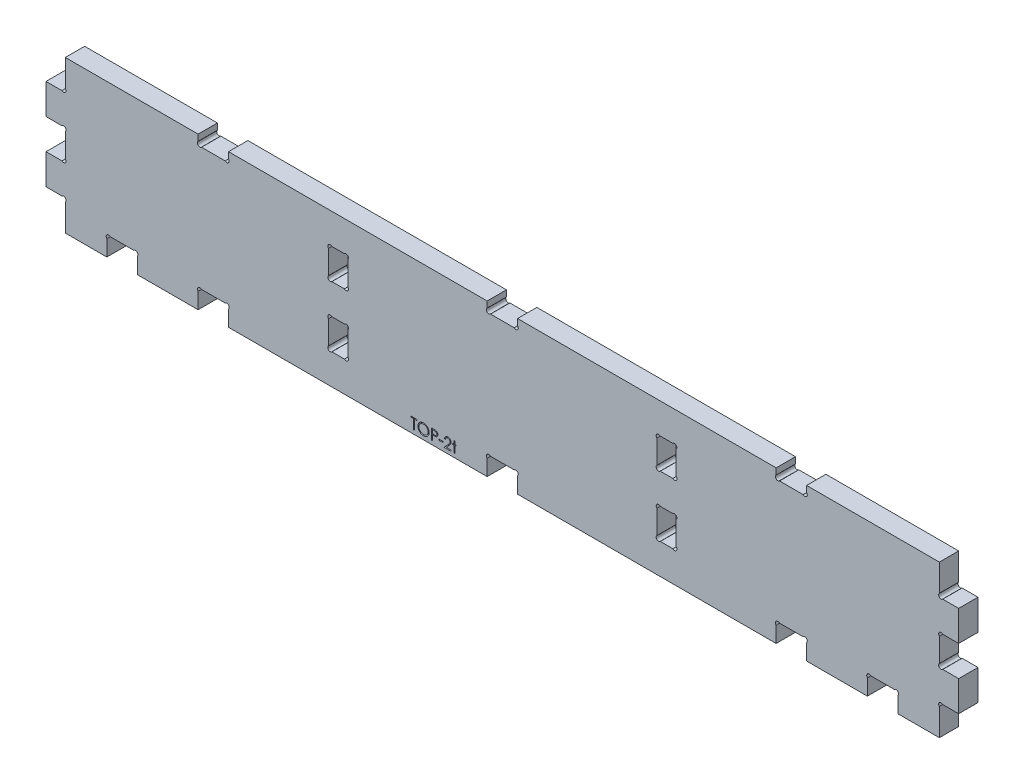
from build123d import *

# Parameters (mm, degrees)
BOSS_EXTRUDE1_OUTLINE_W        = 50
BOSS_EXTRUDE1_OUTLINE_H        = 6.35
BOSS_EXTRUDE1_DEPTH            = 300
SKETCH1_W                      = 10
SKETCH1_H                      = 6.35
F_250_TOOTH_DEPTH              = 305.204409074
F_1_16_0_0625_DIAMETER_HOLE1_D = 1.5875
LPATTERN1_COUNT                = 2
LPATTERN1_PITCH                = 95
LPATTERN1_COL_COUNT            = 2
LPATTERN1_COL_PITCH            = 95
LPATTERN4_COUNT                = 2
LPATTERN4_PITCH                = 125
LPATTERN4_COL_COUNT            = 2
LPATTERN4_COL_PITCH            = 125
SKETCH7_W                      = 6.35
SKETCH7_H                      = 10
F_2T_CUT_DEPTH                 = 305.204409074
LPATTERN2_COUNT                = 3
LPATTERN2_PITCH                = 20
F_1_16_0_0625_DIAMETER_HOLE3_D = 1.5875
MIRROR2_COPY_1_SKETCH_W        = 6.35
MIRROR2_COPY_1_SKETCH_H        = 10
MIRROR2_COPY_1_DEPTH           = 305.204409074
MIRROR2_COPY_2_SKETCH_W        = 6.35
MIRROR2_COPY_2_SKETCH_H        = 10
MIRROR2_COPY_2_DEPTH           = 305.204409074
SKETCH14_W                     = 10
SKETCH14_H                     = 3.175
F_125_TOOTH_DEPTH              = 305.204409074
F_1_16_0_0625_DIAMETER_HOLE2_D = 1.5875
LPATTERN3_COUNT                = 2
LPATTERN3_PITCH                = 95
LPATTERN3_COL_COUNT            = 2
LPATTERN3_COL_PITCH            = 95
SKETCH29_W                     = 6.35
SKETCH29_H                     = 10
CUT_EXTRUDE2_DEPTH             = 305.204409074
F_1_16_0_0625_DIAMETER_HOLE5_D = 1.5875
SKETCH33_W                     = 1.346153846
SKETCH33_H                     = 0.358974359
ETCH_DEPTH                     = 1.25


# Read off the part's stored shape, not the designer's step: Boss-Extrude1
with BuildPart() as part:
    # Boss-Extrude1 outline → Boss-Extrude1 (new body)
    with BuildSketch(Plane.YZ):
        with Locations((25, 3.175)):
            Rectangle(BOSS_EXTRUDE1_OUTLINE_W, BOSS_EXTRUDE1_OUTLINE_H)
    extrude(amount=BOSS_EXTRUDE1_DEPTH)

    # Sketch1 → 250-tooth (cut, through all)
    with BuildSketch(Plane.XY.offset(6.35)):
        with Locations((150, 3.175)):
            Rectangle(SKETCH1_W, SKETCH1_H)
    f_250_tooth = extrude(amount=-F_250_TOOTH_DEPTH, mode=Mode.SUBTRACT)

    # 1/16 (0.0625) Diameter Hole1 (through all)
    with Locations(Plane.XY.offset(6.35)):
        with Locations((145.5588, 5.7912), (150, 3.175), (154.4412, 5.7912)):
            f_1_16_0_0625_diameter_hole1 = Hole(F_1_16_0_0625_DIAMETER_HOLE1_D / 2)

    # LPattern1: 250-tooth, 1/16 (0.0625) Diameter Hole1 ×2
    with Locations(*[(i * LPATTERN1_PITCH, 0, 0) for i in range(1, LPATTERN1_COUNT)]):
        add(f_250_tooth, mode=Mode.SUBTRACT)
        add(f_1_16_0_0625_diameter_hole1, mode=Mode.SUBTRACT)

    # LPattern1 col: 250-tooth, 1/16 (0.0625) Diameter Hole1 ×2
    with Locations(*[(-i * LPATTERN1_COL_PITCH, 0, 0) for i in range(1, LPATTERN1_COL_COUNT)]):
        add(f_250_tooth, mode=Mode.SUBTRACT)
        add(f_1_16_0_0625_diameter_hole1, mode=Mode.SUBTRACT)

    # LPattern4: 250-tooth, 1/16 (0.0625) Diameter Hole1 ×2
    with Locations(*[(i * LPATTERN4_PITCH, 0, 0) for i in range(1, LPATTERN4_COUNT)]):
        add(f_250_tooth, mode=Mode.SUBTRACT)
        add(f_1_16_0_0625_diameter_hole1, mode=Mode.SUBTRACT)

    # LPattern4 col: 250-tooth, 1/16 (0.0625) Diameter Hole1 ×2
    with Locations(*[(-i * LPATTERN4_COL_PITCH, 0, 0) for i in range(1, LPATTERN4_COL_COUNT)]):
        add(f_250_tooth, mode=Mode.SUBTRACT)
        add(f_1_16_0_0625_diameter_hole1, mode=Mode.SUBTRACT)

    # Sketch7 → 2t_cut (cut, through all)
    with BuildSketch(Plane.XY.offset(6.35)):
        with Locations((3.175, 45)):
            Rectangle(SKETCH7_W, SKETCH7_H)
    f_2t_cut = extrude(amount=-F_2T_CUT_DEPTH, mode=Mode.SUBTRACT)

    # LPattern2: 2t_cut ×3
    with Locations(*[(0, -i * LPATTERN2_PITCH, 0) for i in range(1, LPATTERN2_COUNT)]):
        add(f_2t_cut, mode=Mode.SUBTRACT)

    # 1/16 (0.0625) Diameter Hole3 (through all)
    with Locations(Plane.XY.offset(6.35)):
        with Locations((5.7912, 9.4412), (5.7912, 40.5588), (5.7912, 29.4412), (5.7912, 20.5588)):
            f_1_16_0_0625_diameter_hole3 = Hole(F_1_16_0_0625_DIAMETER_HOLE3_D / 2)

    # Mirror2: 2t_cut, 1/16 (0.0625) Diameter Hole3 across plane
    add(f_2t_cut.mirror(Plane(origin=(150, 0, 0), x_dir=(0, 0, 1), z_dir=(1, 0, 0))), mode=Mode.SUBTRACT)
    add(f_1_16_0_0625_diameter_hole3.mirror(Plane(origin=(150, 0, 0), x_dir=(0, 0, 1), z_dir=(1, 0, 0))), mode=Mode.SUBTRACT)

    # Mirror2 copy 1 sketch → Mirror2 copy 1 (cut, through all)
    with BuildSketch(Plane(origin=(300, -20, 6.35), x_dir=(-1, 0, 0), z_dir=(0, 0, 1))):
        with Locations((3.175, -45)):
            Rectangle(MIRROR2_COPY_1_SKETCH_W, MIRROR2_COPY_1_SKETCH_H)
    extrude(amount=-MIRROR2_COPY_1_DEPTH, mode=Mode.SUBTRACT)

    # Mirror2 copy 2 sketch → Mirror2 copy 2 (cut, through all)
    with BuildSketch(Plane(origin=(300, -40, 6.35), x_dir=(-1, 0, 0), z_dir=(0, 0, 1))):
        with Locations((3.175, -45)):
            Rectangle(MIRROR2_COPY_2_SKETCH_W, MIRROR2_COPY_2_SKETCH_H)
    extrude(amount=-MIRROR2_COPY_2_DEPTH, mode=Mode.SUBTRACT)

    # Sketch14 → 125-tooth (cut, through all)
    with BuildSketch(Plane.XY.offset(6.35)):
        with Locations((150, 48.4125)):
            Rectangle(SKETCH14_W, SKETCH14_H)
    f_125_tooth = extrude(amount=-F_125_TOOTH_DEPTH, mode=Mode.SUBTRACT)

    # 1/16 (0.0625) Diameter Hole2 (through all)
    with Locations(Plane.XY.offset(6.35)):
        with Locations((154.4412, 47.3838), (150, 48.4125), (145.5588, 47.3838)):
            f_1_16_0_0625_diameter_hole2 = Hole(F_1_16_0_0625_DIAMETER_HOLE2_D / 2)

    # LPattern3: 125-tooth, 1/16 (0.0625) Diameter Hole2 ×2
    with Locations(*[(i * LPATTERN3_PITCH, 0, 0) for i in range(1, LPATTERN3_COUNT)]):
        add(f_125_tooth, mode=Mode.SUBTRACT)
        add(f_1_16_0_0625_diameter_hole2, mode=Mode.SUBTRACT)

    # LPattern3 col: 125-tooth, 1/16 (0.0625) Diameter Hole2 ×2
    with Locations(*[(-i * LPATTERN3_COL_PITCH, 0, 0) for i in range(1, LPATTERN3_COL_COUNT)]):
        add(f_125_tooth, mode=Mode.SUBTRACT)
        add(f_1_16_0_0625_diameter_hole2, mode=Mode.SUBTRACT)

    # Sketch29 → Cut-Extrude2 (cut, through all)
    with BuildSketch(Plane.XY.offset(6.35)):
        with Locations((96.025, 34.999999939)):
            Rectangle(SKETCH29_W, SKETCH29_H)
    cut_extrude2 = extrude(amount=-CUT_EXTRUDE2_DEPTH, mode=Mode.SUBTRACT)

    # 1/16 (0.0625) Diameter Hole5 (through all)
    with Locations(Plane.XY.offset(6.35)):
        with Locations((93.4088, 39.441199939), (98.6412, 30.558799939), (93.4088, 30.558799939), (98.6412, 39.441199939)):
            f_1_16_0_0625_diameter_hole5 = Hole(F_1_16_0_0625_DIAMETER_HOLE5_D / 2)

    # Sketch-Pattern1: Cut-Extrude2, 1/16 (0.0625) Diameter Hole5 at 3 more places
    with Locations((107.95, 0, 0), (107.95, -20, 0), (0, -20, 0)):
        add(cut_extrude2, mode=Mode.SUBTRACT)
        add(f_1_16_0_0625_diameter_hole5, mode=Mode.SUBTRACT)

    # Sketch33 → etch (cut)
    # profile 1 of 6: a face of its own
    with BuildSketch(Plane.XY.offset(6.35)):
        Polygon((134.057692308, 4.83974359), (134.371794872, 4.83974359), (134.371794872, 3.807692308), (134.820512821, 3.807692308), (134.820512821, 3.493589744), (134.371794872, 3.493589744), (134.371794872, 1.25), (134.057692308, 1.25), (134.057692308, 3.493589744), (133.608974359, 3.493589744), (133.608974359, 3.807692308), (134.057692308, 3.807692308), align=None)
    # profile 2 of 6: a face of its own
    with BuildSketch(Plane.XY.offset(6.35)):
        with BuildLine():
            Line((131.275641026, 3.673076923), (130.961538462, 3.673076923))
            add(Edge.make_bspline(
                [(130.961538462, 3.673076923), (130.963585615, 3.714747811), (130.967606169, 3.796588325), (130.986434458, 3.915912232), (131.013375335, 4.029967031), (131.051466789, 4.137836945), (131.098773067, 4.240475752), (131.155503094, 4.337475767), (131.222696945, 4.428466956), (131.298903679, 4.512605799), (131.381672318, 4.58979337), (131.470978257, 4.656448613), (131.564823285, 4.712766284), (131.662922684, 4.759847526), (131.766383247, 4.795187372), (131.874266105, 4.821409012), (131.987045241, 4.837185357), (132.063885263, 4.838881143), (132.102964744, 4.83974359)],
                knots=[0, 0, 0, 0, 1.10065271, 2.161652631, 3.183658789, 4.190468796, 5.17591951, 6.163126047, 7.15150782, 8.156236427, 9.156009102, 10.134482811, 11.092018607, 12.041330605, 13.001268258, 13.972401359, 14.968799086, 16, 16, 16, 16], degree=3))
            add(Edge.make_bspline(
                [(132.102964744, 4.83974359), (132.141342818, 4.838845133), (132.216754362, 4.837079698), (132.326816377, 4.821918669), (132.431593671, 4.798173078), (132.530881438, 4.764857661), (132.623887502, 4.720073234), (132.711310547, 4.666275695), (132.794191358, 4.604055864), (132.868798141, 4.53080205), (132.937306221, 4.452599666), (132.996408476, 4.369111762), (133.047021639, 4.282882477), (133.089209319, 4.193254275), (133.120265458, 4.099383247), (133.143843666, 4.002636044), (133.15717108, 3.902011233), (133.159216503, 3.833904677), (133.16025641, 3.799278846)],
                knots=[0, 0, 0, 0, 1.111607364, 2.184268762, 3.212621178, 4.221274766, 5.211760367, 6.196651075, 7.1921475, 8.207485113, 9.220403448, 10.201281604, 11.166441695, 12.114753415, 13.065576456, 14.026450734, 14.996634279, 16, 16, 16, 16], degree=3))
            add(Edge.make_bspline(
                [(133.16025641, 3.799278846), (133.158563147, 3.750531012), (133.155206336, 3.653890798), (133.126491959, 3.511875935), (133.081645448, 3.374282516), (133.027648092, 3.263545214), (132.973175647, 3.17431172), (132.92408814, 3.100843015), (132.866623329, 3.021737547), (132.799944831, 2.93726021), (132.725431959, 2.846749304), (132.642409795, 2.750259509), (132.550286313, 2.648787739), (132.485627813, 2.579482138), (132.452123397, 2.543569712)],
                knots=[0, 0, 0, 0, 1.184426356, 2.348067706, 3.509069118, 4.696110526, 5.333549288, 6.050745305, 6.844228056, 7.710549037, 8.667450064, 9.695053472, 10.805634456, 12, 12, 12, 12], degree=3))
            Line((132.452123397, 2.543569712), (131.576422276, 1.608974359))
            Line((131.576422276, 1.608974359), (133.205128205, 1.608974359))
            Line((133.205128205, 1.608974359), (133.205128205, 1.25))
            Line((133.205128205, 1.25), (130.826923077, 1.25))
            Line((130.826923077, 1.25), (132.184294872, 2.698517628))
            add(Edge.make_bspline(
                [(132.184294872, 2.698517628), (132.217342759, 2.733015935), (132.280820986, 2.799280121), (132.370603563, 2.896023081), (132.451242551, 2.985772622), (132.523259944, 3.068359171), (132.585093449, 3.144990738), (132.639965681, 3.213185442), (132.683931272, 3.275939892), (132.731646668, 3.348680506), (132.777860649, 3.437492823), (132.817573005, 3.546026513), (132.841787853, 3.657753765), (132.844692689, 3.733255802), (132.846153846, 3.771233974)],
                knots=[0, 0, 0, 0, 1.329631726, 2.553950428, 3.673215718, 4.687767853, 5.603093632, 6.413772471, 7.123043292, 7.734684054, 8.834405432, 9.900288307, 10.943827018, 12, 12, 12, 12], degree=3))
            add(Edge.make_bspline(
                [(132.846153846, 3.771233974), (132.845518104, 3.795115373), (132.844265178, 3.842181023), (132.83320748, 3.911186782), (132.816496974, 3.977751596), (132.792551716, 4.042080215), (132.760944976, 4.103525867), (132.722471596, 4.162163347), (132.678081533, 4.218852313), (132.626730263, 4.272005611), (132.570318744, 4.320686816), (132.510724494, 4.363810902), (132.44767439, 4.399850012), (132.381434268, 4.429393509), (132.312188798, 4.452568891), (132.239804053, 4.46862747), (132.164480037, 4.478709954), (132.113046541, 4.480074126), (132.086838942, 4.480769231)],
                knots=[0, 0, 0, 0, 0.991446411, 1.95395049, 2.89581595, 3.838931463, 4.798493298, 5.75982156, 6.748411868, 7.785213223, 8.824556874, 9.840280684, 10.836137867, 11.835679398, 12.848801643, 13.863922112, 14.911575587, 16, 16, 16, 16], degree=3))
            add(Edge.make_bspline(
                [(132.086838942, 4.480769231), (132.05946811, 4.480054199), (132.005716313, 4.478649993), (131.92679728, 4.468827329), (131.851511503, 4.451881489), (131.7796696, 4.428704814), (131.711150014, 4.399246266), (131.64628597, 4.362554521), (131.585223081, 4.318771028), (131.527846557, 4.269130471), (131.474982578, 4.21386287), (131.428535703, 4.152252907), (131.387951688, 4.085425492), (131.352542455, 4.013560941), (131.323786765, 3.936007161), (131.301813614, 3.853039456), (131.284426768, 3.765018075), (131.278618247, 3.70423299), (131.275641026, 3.673076923)],
                knots=[0, 0, 0, 0, 1.031018746, 2.02475058, 2.990194455, 3.934040569, 4.864654155, 5.795059489, 6.735614925, 7.690564532, 8.649604399, 9.611025574, 10.590972636, 11.591080095, 12.624614302, 13.701020113, 14.821632451, 16, 16, 16, 16], degree=3))
        make_face()
    # profile 3 of 6: a face of its own
    with BuildSketch(Plane.XY.offset(6.35)):
        with Locations((129.884615385, 2.596153847)):
            Rectangle(SKETCH33_W, SKETCH33_H)
    # profile 4 of 6: a face of its own
    with BuildSketch(Plane.XY.offset(6.35)):
        with BuildLine():
            Line((126.653846154, 4.75), (127.340244391, 4.75))
            add(Edge.make_bspline(
                [(127.340244391, 4.75), (127.387455297, 4.749948104), (127.47791349, 4.749848668), (127.607628546, 4.746833922), (127.725438277, 4.74280723), (127.831088658, 4.737225337), (127.924904756, 4.730628747), (128.006462056, 4.721376708), (128.076401612, 4.711716412), (128.118308062, 4.701895005), (128.137419872, 4.697415865)],
                knots=[0, 0, 0, 0, 1.415646017, 2.712440637, 3.8905458, 4.950247383, 5.884950622, 6.709939814, 7.411656543, 8, 8, 8, 8], degree=3))
            add(Edge.make_bspline(
                [(128.137419872, 4.697415865), (128.161613406, 4.690793916), (128.209430383, 4.677706054), (128.278331426, 4.65149233), (128.343885271, 4.620410165), (128.40631683, 4.584986225), (128.464858913, 4.543700661), (128.520384954, 4.498227043), (128.572404934, 4.447515475), (128.620626326, 4.392134735), (128.664911124, 4.333014525), (128.703040806, 4.269272295), (128.734968033, 4.201980992), (128.762351305, 4.131187421), (128.782059759, 4.056297097), (128.796906659, 3.977830385), (128.806330287, 3.895795695), (128.807232848, 3.839735827), (128.807692308, 3.811197917)],
                knots=[0, 0, 0, 0, 0.999701418, 1.975846123, 2.934577507, 3.890451536, 4.834027766, 5.787354733, 6.749476667, 7.726910423, 8.712836071, 9.690891519, 10.682875813, 11.679750201, 12.712814741, 13.765529915, 14.8625177, 16, 16, 16, 16], degree=3))
            add(Edge.make_bspline(
                [(128.807692308, 3.811197917), (128.807270883, 3.78242014), (128.806446337, 3.726114476), (128.796550052, 3.643741688), (128.78321986, 3.565023298), (128.762722808, 3.490133847), (128.735877135, 3.419518077), (128.704385082, 3.352096845), (128.666401551, 3.289017173), (128.622756722, 3.230050055), (128.574205127, 3.175140143), (128.520952189, 3.124685348), (128.463212897, 3.07898101), (128.401170749, 3.037924666), (128.3342209, 3.002468387), (128.263378746, 2.970711082), (128.18802853, 2.944040021), (128.135886016, 2.93000996), (128.109375, 2.922876603)],
                knots=[0, 0, 0, 0, 1.121902311, 2.195077645, 3.232258892, 4.234102512, 5.217864754, 6.176164875, 7.132989551, 8.084763148, 9.034132444, 9.988522005, 10.94243251, 11.903244335, 12.886203696, 13.894208494, 14.929344452, 16, 16, 16, 16], degree=3))
            add(Edge.make_bspline(
                [(128.109375, 2.922876603), (128.087447666, 2.918213621), (128.039392639, 2.907994427), (127.960249916, 2.89658597), (127.868104531, 2.88684837), (127.763082251, 2.879547232), (127.645277346, 2.873296864), (127.514626088, 2.86832877), (127.370872011, 2.865598916), (127.270600767, 2.865458123), (127.218249199, 2.865384615)],
                knots=[0, 0, 0, 0, 0.601384939, 1.31797006, 2.144135048, 3.087295005, 4.142315834, 5.309527816, 6.595305764, 8, 8, 8, 8], degree=3))
            Line((127.218249199, 2.865384615), (126.967948718, 2.865384615))
            Line((126.967948718, 2.865384615), (126.967948718, 1.25))
            Line((126.967948718, 1.25), (126.653846154, 1.25))
            Line((126.653846154, 1.25), (126.653846154, 4.75))
        make_face()
        with BuildLine():
            Line((126.967948718, 4.391025641), (126.967948718, 3.224358974))
            Line((126.967948718, 3.224358974), (127.580729167, 3.216646635))
            add(Edge.make_bspline(
                [(127.580729167, 3.216646635), (127.610649092, 3.216631171), (127.668408892, 3.216601319), (127.751845116, 3.220586542), (127.829254403, 3.225187075), (127.900398978, 3.231922998), (127.965310913, 3.241444256), (128.024098442, 3.251055994), (128.076305725, 3.264961356), (128.137404926, 3.283684426), (128.205488274, 3.315617041), (128.279555822, 3.361966931), (128.342326409, 3.42104764), (128.396644705, 3.487475471), (128.439750583, 3.5613746), (128.471306576, 3.640443537), (128.489847733, 3.723871387), (128.492333927, 3.780959525), (128.493589744, 3.809795673)],
                knots=[0, 0, 0, 0, 1.160613943, 2.240541288, 3.23993089, 4.169200891, 5.011653406, 5.7853311, 6.478053781, 7.106038997, 8.262395093, 9.384106736, 10.481365981, 11.59014053, 12.70357646, 13.786202915, 14.881775077, 16, 16, 16, 16], degree=3))
            add(Edge.make_bspline(
                [(128.493589744, 3.809795673), (128.492327097, 3.837934187), (128.489817112, 3.893870069), (128.471161249, 3.975848829), (128.439811935, 4.054084534), (128.396355341, 4.127057619), (128.343614211, 4.193246423), (128.282314868, 4.25074355), (128.212601606, 4.296965253), (128.147753375, 4.326798534), (128.090152189, 4.34501381), (128.040120229, 4.35775865), (127.983629555, 4.367934257), (127.920661775, 4.376173759), (127.851704941, 4.383227221), (127.776166626, 4.388013198), (127.694332983, 4.390814654), (127.637522412, 4.390953609), (127.608072917, 4.391025641)],
                knots=[0, 0, 0, 0, 1.120700087, 2.227813068, 3.331159281, 4.466773991, 5.599788987, 6.693661531, 7.80175334, 8.91857717, 9.525282508, 10.207424825, 10.974604443, 11.810962634, 12.737642355, 13.736264703, 14.826523623, 16, 16, 16, 16], degree=3))
            Line((127.608072917, 4.391025641), (126.967948718, 4.391025641))
        make_face(mode=Mode.SUBTRACT)
    # profile 5 of 6: a face of its own
    with BuildSketch(Plane.XY.offset(6.35)):
        with BuildLine():
            add(Edge.make_bspline(
                [(124.073717949, 4.83974359), (124.138526055, 4.83810211), (124.265814522, 4.834878109), (124.452889419, 4.810199006), (124.631484515, 4.767503616), (124.803054653, 4.710640633), (124.96554763, 4.634786248), (125.120186522, 4.5431011), (125.266603396, 4.434624641), (125.402824778, 4.310195414), (125.527481728, 4.17481196), (125.637307614, 4.03033405), (125.729349908, 3.877635248), (125.804935695, 3.717174417), (125.864234305, 3.549314449), (125.905153349, 3.373160446), (125.931291499, 3.189853756), (125.934347276, 3.064826892), (125.935897436, 3.001402244)],
                knots=[0, 0, 0, 0, 1.065120563, 2.091984664, 3.0946048, 4.079830382, 5.057816894, 6.036188127, 7.030412546, 8.04752943, 9.064399622, 10.05169764, 11.02544977, 11.989514704, 12.962713494, 13.945757189, 14.957906945, 16, 16, 16, 16], degree=3))
            add(Edge.make_bspline(
                [(125.935897436, 3.001402244), (125.934347503, 2.938444797), (125.931292407, 2.814348377), (125.905123629, 2.632204933), (125.864082629, 2.457114236), (125.805486363, 2.289368583), (125.730260885, 2.12879102), (125.637605714, 1.975804066), (125.528464503, 1.830357567), (125.404257652, 1.694044902), (125.26885661, 1.569047431), (125.123626343, 1.460128556), (124.971833023, 1.366404431), (124.811523315, 1.291620757), (124.644823278, 1.231848837), (124.470240955, 1.191096207), (124.288594401, 1.164809163), (124.164723397, 1.161790647), (124.101762821, 1.16025641)],
                knots=[0, 0, 0, 0, 1.043624062, 2.057103931, 3.04512605, 4.022047818, 4.998200453, 5.980619268, 6.982898556, 8.009068085, 9.034988726, 10.034168286, 11.015286542, 11.987931943, 12.962482838, 13.94673481, 14.956375938, 16, 16, 16, 16], degree=3))
            add(Edge.make_bspline(
                [(124.101762821, 1.16025641), (124.038338502, 1.161805797), (123.913312286, 1.164860051), (123.72977525, 1.191041456), (123.553497506, 1.23198276), (123.384983155, 1.290492196), (123.224138226, 1.366109427), (123.070648143, 1.458313806), (122.925128996, 1.567720947), (122.788787249, 1.691887521), (122.664038051, 1.827059073), (122.555278675, 1.971893329), (122.463053562, 2.123548785), (122.387690229, 2.282446309), (122.32802577, 2.447817752), (122.287320952, 2.620766229), (122.260985, 2.800305735), (122.257950153, 2.922548634), (122.256410256, 2.984575321)],
                knots=[0, 0, 0, 0, 1.053102029, 2.075944431, 3.073151272, 4.055350789, 5.033113405, 6.020478099, 7.024410459, 8.052272461, 9.079885166, 10.07527673, 11.055994387, 12.023226415, 12.992069828, 13.970394897, 14.97016774, 16, 16, 16, 16], degree=3))
            add(Edge.make_bspline(
                [(122.256410256, 2.984575321), (122.256944892, 3.02620799), (122.258007418, 3.108948113), (122.270799111, 3.231814713), (122.289360812, 3.352705371), (122.315962724, 3.471276319), (122.350754391, 3.587237304), (122.391806419, 3.701388067), (122.441946264, 3.81257179), (122.498626912, 3.921315182), (122.56188872, 4.025923088), (122.63176447, 4.124802671), (122.705799838, 4.218783668), (122.786963232, 4.305430672), (122.872579677, 4.387264328), (122.964038055, 4.463027045), (123.0607803, 4.533401996), (123.163222679, 4.596822337), (123.268840954, 4.654181472), (123.377717732, 4.703403323), (123.488374303, 4.745649384), (123.601328951, 4.779890209), (123.716281723, 4.806922245), (123.833483508, 4.825329599), (123.952840934, 4.838153917), (124.033252253, 4.839211419), (124.073717949, 4.83974359)],
                knots=[0, 0, 0, 0, 1.037015668, 2.060948919, 3.074880161, 4.083647147, 5.086022904, 6.090072063, 7.104153813, 8.122640571, 9.144368836, 10.147691507, 11.138137339, 12.123020368, 13.103399296, 14.087645067, 15.080126199, 16.082011238, 17.087798457, 18.072939717, 19.057185487, 20.037253025, 21.01195951, 21.997135196, 22.992090687, 24, 24, 24, 24], degree=3))
        make_face()
        with BuildLine():
            add(Edge.make_bspline(
                [(124.089142628, 4.480769231), (124.055927995, 4.480364341), (123.989816262, 4.479558431), (123.891531725, 4.468942715), (123.794539792, 4.453812826), (123.698820429, 4.432231305), (123.60477414, 4.402827253), (123.511524299, 4.368986345), (123.419921245, 4.327765254), (123.330267387, 4.28119255), (123.243352312, 4.229643629), (123.161339611, 4.172671862), (123.084016967, 4.111613307), (123.0115737, 4.04632547), (122.944222528, 3.976475868), (122.880637826, 3.903123432), (122.823368245, 3.824171541), (122.770882668, 3.741761134), (122.723914828, 3.655999553), (122.682149473, 3.567789691), (122.647985464, 3.476412004), (122.620123088, 3.382857846), (122.597023277, 3.287275387), (122.582389353, 3.188939538), (122.571656993, 3.088344426), (122.570897148, 3.020362572), (122.570512821, 2.985977564)],
                knots=[0, 0, 0, 0, 1.008559885, 2.007477868, 2.99961109, 3.989939068, 4.984837346, 5.991145699, 7.001802488, 8.033829008, 9.059044045, 10.069351652, 11.065060232, 12.050310815, 13.029377138, 14.011219647, 14.996725999, 15.989392538, 16.977580475, 17.965360261, 18.951710183, 19.937753436, 20.929683414, 21.935841486, 22.955955122, 24, 24, 24, 24], degree=3))
            add(Edge.make_bspline(
                [(122.570512821, 2.985977564), (122.571787682, 2.935415343), (122.57429573, 2.835943813), (122.5962533, 2.690175669), (122.630075275, 2.550087383), (122.679932641, 2.416445474), (122.742283256, 2.288101191), (122.819310146, 2.166193086), (122.910569232, 2.050688212), (123.014232758, 1.942392943), (123.127555465, 1.843547138), (123.247888195, 1.75678373), (123.373941802, 1.68337348), (123.506045005, 1.623568408), (123.643492544, 1.57617867), (123.787170095, 1.543700039), (123.936120555, 1.522324583), (124.03765121, 1.520271827), (124.089142628, 1.519230769)],
                knots=[0, 0, 0, 0, 1.032063989, 2.030389145, 3.003944642, 3.970395727, 4.937377036, 5.913328081, 6.909231446, 7.93887556, 8.970685674, 9.976071282, 10.964166581, 11.944589148, 12.933237628, 13.927779006, 14.949070134, 16, 16, 16, 16], degree=3))
            add(Edge.make_bspline(
                [(124.089142628, 1.519230769), (124.12375213, 1.519706274), (124.192393166, 1.520649342), (124.294488689, 1.530148018), (124.3947449, 1.545379888), (124.49302118, 1.567310543), (124.589205992, 1.59475775), (124.683700795, 1.627365478), (124.775499085, 1.668046682), (124.865758923, 1.712994633), (124.952155164, 1.764234791), (125.034630697, 1.81927294), (125.111106677, 1.880241561), (125.183495748, 1.944559374), (125.251123437, 2.013523221), (125.313532421, 2.087043443), (125.370512553, 2.1655841), (125.4229782, 2.247869506), (125.469781463, 2.333865759), (125.510560562, 2.422395437), (125.545156678, 2.513240546), (125.573085182, 2.606532118), (125.594970644, 2.702092966), (125.610050564, 2.800051045), (125.620599003, 2.900210387), (125.62139408, 2.967954243), (125.621794872, 3.002103365)],
                knots=[0, 0, 0, 0, 1.047197238, 2.076906641, 3.100256066, 4.114471768, 5.12198147, 6.126382909, 7.136867548, 8.15857795, 9.17633901, 10.174870724, 11.156907918, 12.133735059, 13.104061851, 14.077631395, 15.04955518, 16.038496417, 17.029181396, 18.010275684, 18.986308667, 19.968651475, 20.955262928, 21.950658345, 22.966943676, 24, 24, 24, 24], degree=3))
            add(Edge.make_bspline(
                [(125.621794872, 3.002103365), (125.621393759, 3.03601887), (125.620598077, 3.10329652), (125.610055603, 3.202757338), (125.594954712, 3.30001055), (125.573192004, 3.394674353), (125.545141851, 3.486772878), (125.51055452, 3.576219625), (125.469769221, 3.663347821), (125.422960996, 3.747942118), (125.370345173, 3.829116855), (125.31285093, 3.906719268), (125.249485581, 3.979292009), (125.182059557, 4.048626703), (125.108888671, 4.113244593), (125.030304377, 4.173167114), (124.947260699, 4.229840388), (124.859333464, 4.28096595), (124.76858951, 4.328180182), (124.675475552, 4.368631186), (124.581046453, 4.403003305), (124.48554234, 4.43232027), (124.388159362, 4.4537283), (124.289555533, 4.46895635), (124.189867275, 4.479554736), (124.122824055, 4.480363114), (124.089142628, 4.480769231)],
                knots=[0, 0, 0, 0, 1.02996197, 2.043119294, 3.035359645, 4.018872909, 4.991431989, 5.957985074, 6.929999688, 7.912076566, 8.892894881, 9.867085534, 10.843653904, 11.817741046, 12.803660682, 13.806313499, 14.818574707, 15.856120519, 16.894564902, 17.924820532, 18.937903209, 19.946497019, 20.957711757, 21.963978472, 22.977135795, 24, 24, 24, 24], degree=3))
        make_face(mode=Mode.SUBTRACT)
    # profile 6 of 6: a face of its own
    with BuildSketch(Plane.XY.offset(6.35)):
        Polygon((120.057692308, 4.391025641), (120.057692308, 4.75), (121.897435897, 4.75), (121.897435897, 4.391025641), (121.134615385, 4.391025641), (121.134615385, 1.25), (120.820512821, 1.25), (120.820512821, 4.391025641), align=None)
    extrude(amount=-ETCH_DEPTH, mode=Mode.SUBTRACT)


solid = part.part
